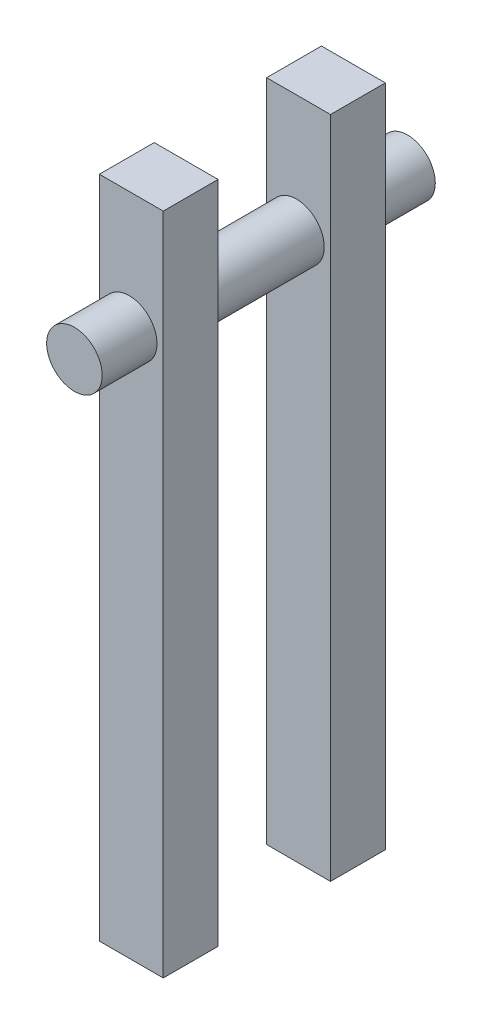
from build123d import *

# Parameters (mm, degrees)
SKETCH1_W                = 7.9
SKETCH1_H                = 95.7
BOSS_EXTRUDE1_DEPTH      = 9.2
SKETCH1_3_W              = 7.9
SKETCH1_3_H              = 95.7
BOSS_EXTRUDE2_DEPTH      = 9.2
BOSS_EXTRUDE3_DEPTH      = 32
BOSS_EXTRUDE3_DEPTH_BACK = 16
SKETCH2_R                = 4


with BuildPart() as part:
    # Sketch1 → Boss-Extrude1 (new body)
    with BuildSketch(Plane(origin=(0, 0, 0), x_dir=(0, 0, -1), z_dir=(1, 0, 0))):
        with Locations((-28.171698113, -0.670754717)):
            Rectangle(SKETCH1_W, SKETCH1_H)
    extrude(amount=BOSS_EXTRUDE1_DEPTH)

    # Sketch1<3> → Boss-Extrude2 (add)
    with BuildSketch(Plane(origin=(0, 0, 0), x_dir=(0, 0, -1), z_dir=(1, 0, 0))):
        with Locations((-28.171698113, -0.670754717)):
            Rectangle(SKETCH1_3_W, SKETCH1_3_H)
        with Locations((-4.071698113, -0.670754717)):
            Rectangle(SKETCH1_3_W, SKETCH1_3_H)
    extrude(amount=BOSS_EXTRUDE2_DEPTH)


with BuildPart() as boss_extrude2_piece_1:
    # of the separate pieces the step leaves, piece 1, a body of its own (boss_extrude2_pieces)
    add(part.part.solids().sort_by_distance((0, 47.179245283, 8.021698113))[0])



with BuildPart() as boss_extrude2_piece_2:
    # of the separate pieces the step leaves, piece 2, a body of its own (boss_extrude2_pieces)
    add(part.part.solids().sort_by_distance((0, 47.179245283, 32.121698113))[0])


with BuildPart() as boss_extrude2_piece_1_1:
    add(boss_extrude2_piece_1.part)

    add(boss_extrude2_piece_2.part)  # Boss-Extrude3 merges Boss-Extrude2 piece 2
    # Sketch2 → Boss-Extrude3 (add, two sides: drawn at the far end of the back side and taken through both)
    with BuildSketch(Plane.XY.offset(8.021698113).offset(-BOSS_EXTRUDE3_DEPTH_BACK)):
        with Locations((4.3, 30.179245283)):
            Circle(SKETCH2_R)
    extrude(amount=BOSS_EXTRUDE3_DEPTH + BOSS_EXTRUDE3_DEPTH_BACK)


solid = boss_extrude2_piece_1_1.part
